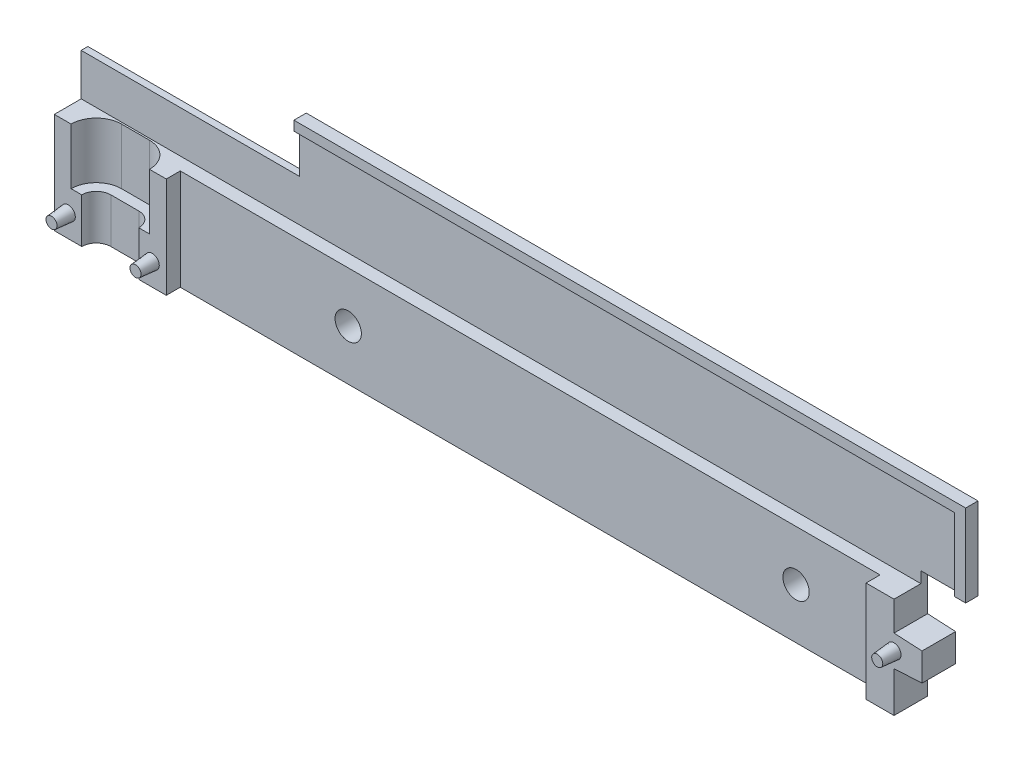
from build123d import *
from OCP.BRepFilletAPI import BRepFilletAPI_MakeChamfer

# Parameters (mm, degrees)
BOSS_EXTRUDE1_DEPTH      = 6
BOSS_EXTRUDE1_DEPTH_BACK = 6
CUT_EXTRUDE1_DEPTH       = 157
CUT_EXTRUDE4_DEPTH       = 2.5
CUT_EXTRUDE4_DEPTH_BACK  = 2.5
SKETCH8_W                = 125
SKETCH8_H                = 34.7
CUT_EXTRUDE5_DEPTH       = 131.348014108
CUT_EXTRUDE5_DEPTH_BACK  = 131.348014108
SKETCH9_R                = 2.35
CHAMFER2_SIZE            = 5
CHAMFER2_SIZE_2          = 0.262038896
CUT_EXTRUDE8_DEPTH       = 10
CUT_EXTRUDE9_DEPTH       = 131.715773363
SKETCH16_W               = 214.344642296
SKETCH16_H               = 84.645654919
CUT_EXTRUDE10_DEPTH      = 131.348014108
SKETCH17_W               = 2
SKETCH17_H               = 14.7
CUT_EXTRUDE11_DEPTH      = 3.8
SKETCH19_R               = 1.25
BOSS_EXTRUDE5_DEPTH      = 3
BOSS_EXTRUDE5_2_DEPTH    = 3
BOSS_EXTRUDE5_3_DEPTH    = 3
CHAMFER3_SIZE            = 3
CHAMFER3_SIZE_2          = 0.262465991
CHAMFER4_SIZE            = 3
CHAMFER4_SIZE_2          = 0.262465991
CHAMFER5_SIZE            = 3
CHAMFER5_SIZE_2          = 0.262465991


# Some blends are built 0.0001 mm under size
with BuildPart() as part:
    # Sketch1 → Boss-Extrude1 (new, two sides: drawn at the far end of the back side and taken through both)
    with BuildSketch(Plane.XY.offset(-BOSS_EXTRUDE1_DEPTH_BACK)):
        Polygon((-127.819104229, -9.862903226), (22.180895771, -9.862903226), (22.180895771, -2.612903226), (27.180895771, -2.612903226), (27.180895771, 2.887096774), (22.180895771, 2.887096774), (22.180895771, 10.137096774), (31.180895771, 10.137096774), (31.180895771, 23.637096774), (31.180895771, 24.837096774), (-88.819104229, 24.837096774), (-88.819104229, 23.637096774), (-88.819104229, 15.637096774), (-127.819104229, 15.637096774), align=None)
    extrude(amount=BOSS_EXTRUDE1_DEPTH + BOSS_EXTRUDE1_DEPTH_BACK)

    # Sketch2 → Cut-Extrude1 (cut)
    with BuildSketch(Plane.ZY.offset(127.819104229)):
        Polygon((-4.8, 23.137096774), (-4.8, 8.137096774), (4.8, 8.137096774), (4.8, 23.137096774), (3.8, 23.137096774), (3.8, 24.837096774), (-3.8, 24.837096774), (-3.8, 23.137096774), align=None)
    extrude(amount=-CUT_EXTRUDE1_DEPTH, mode=Mode.SUBTRACT)

    # Sketch8 → Cut-Extrude4 (cut, two sides: drawn at the far end of the back side and taken through both)
    with BuildSketch(Plane.XY.offset(-CUT_EXTRUDE4_DEPTH_BACK)):
        with Locations((-45.319104229, 7.487096774)):
            Rectangle(SKETCH8_W, SKETCH8_H)
    extrude(amount=CUT_EXTRUDE4_DEPTH + CUT_EXTRUDE4_DEPTH_BACK, mode=Mode.SUBTRACT)

    # Sketch9 → Cut-Extrude5 (cut, two sides: drawn at the far end of the back side and taken through both)
    with BuildSketch(Plane.XY.offset(-CUT_EXTRUDE5_DEPTH_BACK)):
        with Locations((-77.819104229, -0.862903226)):
            Circle(SKETCH9_R)
        with Locations((2.180895771, -0.862903226)):
            Circle(SKETCH9_R)
    extrude(amount=CUT_EXTRUDE5_DEPTH + CUT_EXTRUDE5_DEPTH_BACK, mode=Mode.SUBTRACT)

    # Chamfer2
    chamfer2_edges_1 = [part.edges().sort_by_distance(p)[0] for p in [
        (27.180895771, -2.612903226, 0),
    ]]
    chamfer2_side_1 = [part.faces().sort_by_distance(p)[0] for p in [
        (27.175654993, -2.612903226, 0),
    ]]
    chamfer2_edges_2 = [part.edges().sort_by_distance(p)[0] for p in [
        (27.180895771, 2.887096774, 0),
    ]]
    chamfer2_side_2 = [part.faces().sort_by_distance(p)[0] for p in [
        (27.180895771, 2.881855996, 0),
    ]]
    chamfer2 = BRepFilletAPI_MakeChamfer(part.part.solid().wrapped)
    for e in chamfer2_edges_1:
        chamfer2.Add(CHAMFER2_SIZE - 0.0001, CHAMFER2_SIZE_2 - 0.0001, e.wrapped, chamfer2_side_1[0].wrapped)
    for e in chamfer2_edges_2:
        chamfer2.Add(CHAMFER2_SIZE_2 - 0.0001, CHAMFER2_SIZE - 0.0001, e.wrapped, chamfer2_side_2[0].wrapped)
    add(Compound.cast(chamfer2.Shape()), mode=Mode.REPLACE)  # a hair under: the kernel refuses the full size

    # Sketch14 → Cut-Extrude8 (cut)
    with BuildSketch(Plane(origin=(0, 8.137096774, 0), x_dir=(1, 0, 0), z_dir=(0, 1, 0))):
        with BuildLine():
            Line((-120.319104229, 4.5), (-115.319104229, 4.5))
            ThreePointArc((-115.319104229, 4.5), (-110.819104229, 0), (-115.319104229, -4.5))
            Line((-115.319104229, -4.5), (-120.319104229, -4.5))
            ThreePointArc((-120.319104229, -4.5), (-124.819104229, 0), (-120.319104229, 4.5))
        make_face()
    extrude(amount=-CUT_EXTRUDE8_DEPTH, mode=Mode.SUBTRACT)

    # Sketch15 → Cut-Extrude9 (cut, through all)
    with BuildSketch(Plane(origin=(0, -1.862903226, 0), x_dir=(1, 0, 0), z_dir=(0, 1, 0))):
        with BuildLine():
            Line((-120.319104229, -2.6), (-115.319104229, -2.6))
            ThreePointArc((-115.319104229, -2.6), (-112.719104229, 0), (-115.319104229, 2.6))
            Line((-115.319104229, 2.6), (-120.319104229, 2.6))
            ThreePointArc((-120.319104229, 2.6), (-122.919104229, 0), (-120.319104229, -2.6))
        make_face()
    extrude(amount=-CUT_EXTRUDE9_DEPTH, mode=Mode.SUBTRACT)

    # Sketch16 → Cut-Extrude10 (cut, through all)
    with BuildSketch(Plane.XY):
        with Locations((-30.272765953, 16.776086779)):
            Rectangle(SKETCH16_W, SKETCH16_H)
    extrude(amount=CUT_EXTRUDE10_DEPTH, mode=Mode.SUBTRACT)

    # Sketch17 → Cut-Extrude11 (cut)
    with BuildSketch(Plane.XY):
        with Locations((30.180895771, 17.487096774)):
            Rectangle(SKETCH17_W, SKETCH17_H)
    extrude(amount=-CUT_EXTRUDE11_DEPTH, mode=Mode.SUBTRACT)


with BuildPart() as body_2:
    # Sketch19 → Boss-Extrude5 (new body)
    with BuildSketch(Plane.XY):
        with Locations((-125.319104229, -5.862903226)):
            Circle(SKETCH19_R)
    extrude(amount=BOSS_EXTRUDE5_DEPTH)

    # Chamfer5
    # the kernel refuses this chamfer: 3, 0.262465991 mm, written as the material it takes off along each edge
    with BuildSketch(Plane(origin=(-125.319104229, -5.862903226, 3), x_dir=(1, 0, 0), z_dir=(0, -1, 0))) as chamfer5_piece_1:
        Polygon((1.25, -CHAMFER5_SIZE), (1.25 - CHAMFER5_SIZE_2 * 0.999999998391, 0), (1.25, 0), align=None)
    revolve(axis=Axis((-125.319104229, -5.862903226, 3), (0, 0, 1)), mode=Mode.SUBTRACT)


with BuildPart() as body_3:
    # Sketch19 → Boss-Extrude5 2 (new body)
    with BuildSketch(Plane.XY):
        with Locations((-110.319104229, -5.862903226)):
            Circle(SKETCH19_R)
    extrude(amount=BOSS_EXTRUDE5_2_DEPTH)

    # Chamfer4
    # the kernel refuses this chamfer: 3, 0.262465991 mm, written as the material it takes off along each edge
    with BuildSketch(Plane(origin=(-110.319104229, -5.862903226, 3), x_dir=(1, 0, 0), z_dir=(0, -1, 0))) as chamfer4_piece_1:
        Polygon((1.25, -CHAMFER4_SIZE), (1.25 - CHAMFER4_SIZE_2 * 0.999999998391, 0), (1.25, 0), align=None)
    revolve(axis=Axis((-110.319104229, -5.862903226, 3), (0, 0, 1)), mode=Mode.SUBTRACT)


with BuildPart() as body_4:
    # Sketch19 → Boss-Extrude5 3 (new body)
    with BuildSketch(Plane.XY):
        with Locations((22.180895771, 0.137096774)):
            Circle(SKETCH19_R)
    extrude(amount=BOSS_EXTRUDE5_3_DEPTH)

    # Chamfer3
    # the kernel refuses this chamfer: 3, 0.262465991 mm, written as the material it takes off along each edge
    with BuildSketch(Plane(origin=(22.180895771, 0.137096774, 3), x_dir=(1, 0, 0), z_dir=(0, -1, 0))) as chamfer3_piece_1:
        Polygon((1.25, -CHAMFER3_SIZE), (1.25 - CHAMFER3_SIZE_2 * 0.999999998391, 0), (1.25, 0), align=None)
    revolve(axis=Axis((22.180895771, 0.137096774, 3), (0, 0, 1)), mode=Mode.SUBTRACT)


solid = Compound([part.part, body_2.part, body_3.part, body_4.part])
